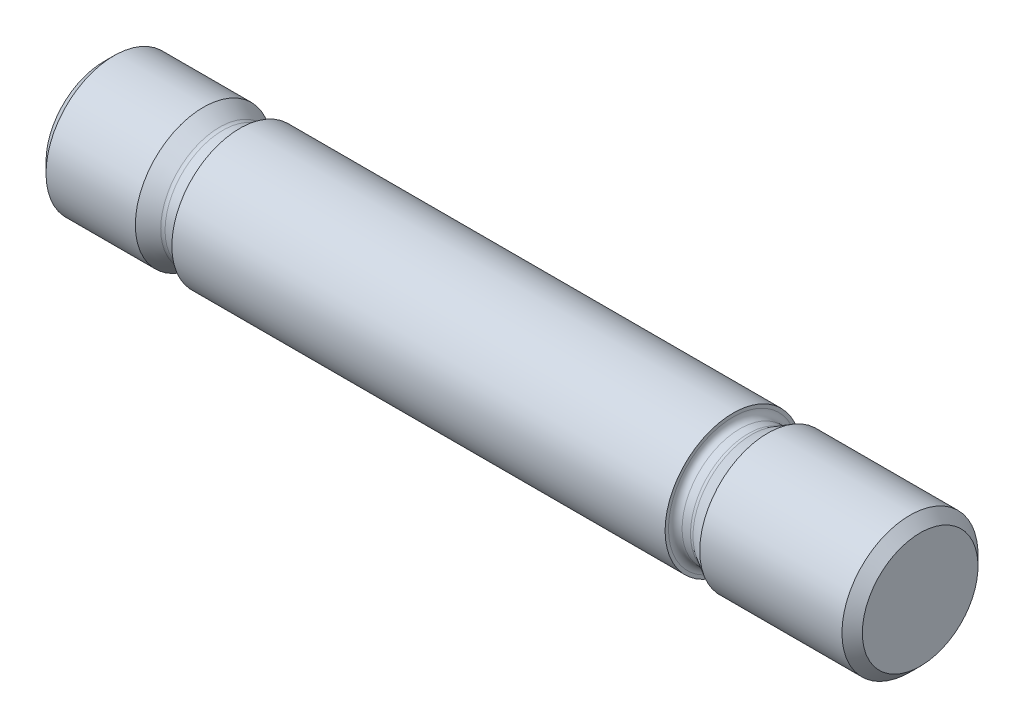
from build123d import *


with BuildPart() as part:
    # BodySke → BaseBody (revolve)
    with BuildSketch(Plane.XY):
        with BuildLine():
            Line((17, 8.633974596), (14.633974596, 10))
            Line((14.633974596, 10), (1.5, 10))
            Line((1.5, 10), (0, 8.5))
            Line((0, 8.5), (0, 0))
            Line((0, 0), (120, 0))
            Line((120, 0), (120, 8.5))
            Line((120, 8.5), (118.5, 10))
            Line((118.5, 10), (97.6, 10))
            Line((97.6, 10), (95.233974596, 8.633974596))
            ThreePointArc((95.233974596, 8.633974596), (94.992793641, 8.534074174), (94.733974596, 8.5))
            Line((94.733974596, 8.5), (93.501923789, 8.5))
            ThreePointArc((93.501923789, 8.5), (92.794817007, 8.792893219), (92.501923789, 9.5))
            Line((92.501923789, 9.5), (92.501923789, 10))
            Line((92.501923789, 10), (20, 10))
            Line((20, 10), (20, 9.5))
            ThreePointArc((20, 9.5), (19.707106781, 8.792893219), (19, 8.5))
            Line((19, 8.5), (17.5, 8.5))
            ThreePointArc((17.5, 8.5), (17.241180955, 8.534074174), (17, 8.633974596))
        make_face()
    revolve(axis=Axis((-3.175, 0, 0), (1, 0, 0)))


solid = part.part
